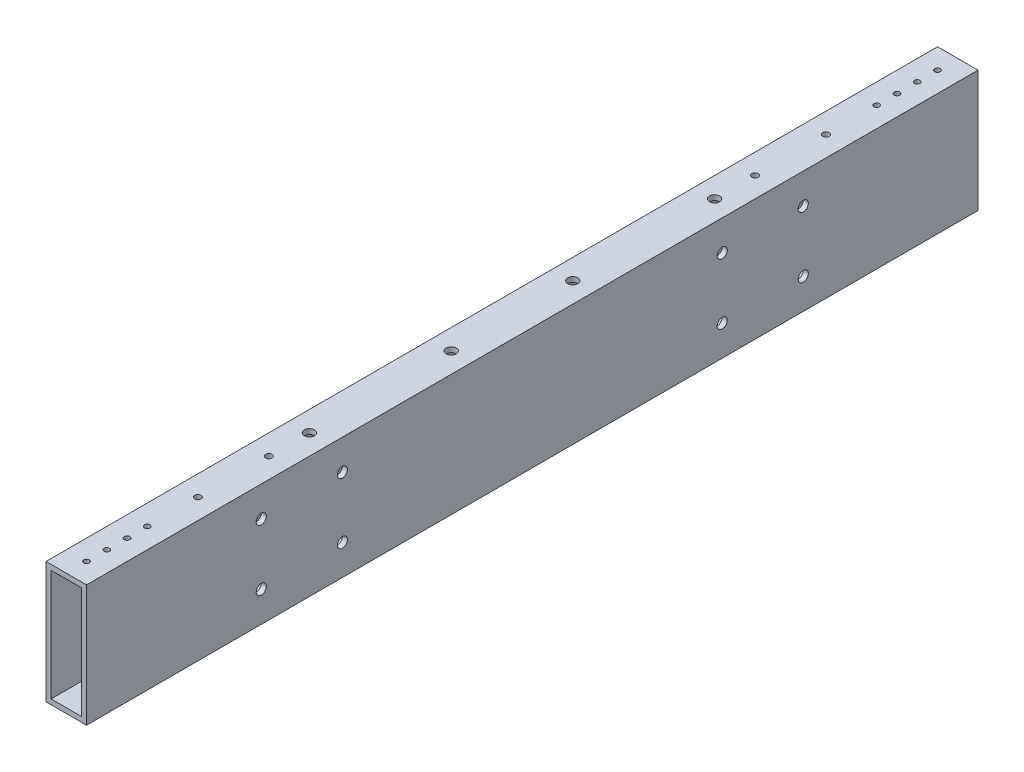
from build123d import *

# Parameters (mm, degrees)
SKETCH1_W                       = 25.4
SKETCH1_H                       = 76.2
SKETCH1_W_2                     = 19.05
SKETCH1_H_2                     = 69.85
BOSS_EXTRUDE1_DEPTH             = 279.4
SKETCH3_R                       = 1.7272
CUT_EXTRUDE2_DEPTH              = 6.35
F_1_4_0_25_DIAMETER_HOLE1_D     = 6.35
F_1_4_0_25_DIAMETER_HOLE1_DEPTH = 25.4
F_1_4_0_25_DIAMETER_HOLE1_TIP   = 1.907732465
F_1_4_0_25_DIAMETER_HOLE2_D     = 6.35
CUT_EXTRUDE3_START              = -5.08
SKETCH2_R                       = 1.7272
CUT_EXTRUDE3_DEPTH              = 5.08
F_10_32_TAPPED_HOLE1_D          = 4.0386
F_10_32_TAPPED_HOLE1_DEPTH      = 13.716
F_10_32_TAPPED_HOLE1_TIP        = 1.213317848


with BuildPart() as part:
    # Sketch1 → Boss-Extrude1 (new, symmetric)
    with BuildSketch(Plane.XY):
        Rectangle(SKETCH1_W, SKETCH1_H)
        Rectangle(SKETCH1_W_2, SKETCH1_H_2, mode=Mode.SUBTRACT)
    extrude(amount=BOSS_EXTRUDE1_DEPTH, both=True)

    # Sketch3 → Cut-Extrude2 (cut)
    with BuildSketch(Plane.XZ.offset(38.1)):
        with Locations((0, 266.7)):
            Circle(SKETCH3_R)
        with Locations((0, 241.3)):
            Circle(SKETCH3_R)
        with Locations((0, 215.9)):
            Circle(SKETCH3_R)
        with Locations((0, 190.5)):
            Circle(SKETCH3_R)
        with Locations((0, 165.1)):
            Circle(SKETCH3_R)
        with Locations((0, 139.7)):
            Circle(SKETCH3_R)
        with Locations((0, 114.3)):
            Circle(SKETCH3_R)
        with Locations((0, 88.9)):
            Circle(SKETCH3_R)
        with Locations((0, 63.5)):
            Circle(SKETCH3_R)
        with Locations((0, 38.1)):
            Circle(SKETCH3_R)
        with Locations((0, 12.7)):
            Circle(SKETCH3_R)
        with Locations((0, -12.7)):
            Circle(SKETCH3_R)
        with Locations((0, -38.1)):
            Circle(SKETCH3_R)
        with Locations((0, -63.5)):
            Circle(SKETCH3_R)
        with Locations((0, -88.9)):
            Circle(SKETCH3_R)
        with Locations((0, -114.3)):
            Circle(SKETCH3_R)
        with Locations((0, -139.7)):
            Circle(SKETCH3_R)
        with Locations((0, -165.1)):
            Circle(SKETCH3_R)
        with Locations((0, -190.5)):
            Circle(SKETCH3_R)
        with Locations((0, -215.9)):
            Circle(SKETCH3_R)
        with Locations((0, -241.3)):
            Circle(SKETCH3_R)
        with Locations((0, -266.7)):
            Circle(SKETCH3_R)
    extrude(amount=-CUT_EXTRUDE2_DEPTH, mode=Mode.SUBTRACT)

    # 1/4 (0.25) Diameter Hole1
    with Locations(Plane.ZY.offset(12.7)):
        with Locations((-119.0625, -19.05), (119.0625, -19.05), (-119.0625, 19.05), (119.0625, 19.05), (169.8625, 19.05), (169.8625, -19.05), (-169.8625, 19.05), (-169.8625, -19.05)):
            Hole(F_1_4_0_25_DIAMETER_HOLE1_D / 2, depth=F_1_4_0_25_DIAMETER_HOLE1_DEPTH)
            with Locations((0, 0, -(F_1_4_0_25_DIAMETER_HOLE1_DEPTH + F_1_4_0_25_DIAMETER_HOLE1_TIP / 2))):  # 118° drill point
                Cone(0, F_1_4_0_25_DIAMETER_HOLE1_D / 2, F_1_4_0_25_DIAMETER_HOLE1_TIP, mode=Mode.SUBTRACT)

    # 1/4 (0.25) Diameter Hole2 (through all)
    with Locations(Plane(origin=(0, 38.1, 0), x_dir=(1, 0, 0), z_dir=(0, 1, 0))):
        with Locations((0, 127), (0, -127), (0, -38.1), (0, 38.1)):
            Hole(F_1_4_0_25_DIAMETER_HOLE2_D / 2)

    # Sketch2 → Cut-Extrude3 (cut)
    with BuildSketch(Plane(origin=(0, 38.1, 0), x_dir=(1, 0, 0), z_dir=(0, 1, 0)).offset(CUT_EXTRUDE3_START)):
        with Locations((0, 266.7)):
            Circle(SKETCH2_R)
        with Locations((0, 254)):
            Circle(SKETCH2_R)
        with Locations((0, 241.3)):
            Circle(SKETCH2_R)
        with Locations((0, 228.6)):
            Circle(SKETCH2_R)
        with Locations((0, -266.7)):
            Circle(SKETCH2_R)
        with Locations((0, -254)):
            Circle(SKETCH2_R)
        with Locations((0, -241.3)):
            Circle(SKETCH2_R)
        with Locations((0, -228.6)):
            Circle(SKETCH2_R)
    extrude(amount=CUT_EXTRUDE3_DEPTH, mode=Mode.SUBTRACT)

    # #10-32 Tapped Hole1
    with Locations(Plane(origin=(0, 38.1, 0), x_dir=(1, 0, 0), z_dir=(0, 1, 0))):
        with Locations((0, -196.85), (0, -152.4), (0, 152.4), (0, 196.85)):
            Hole(F_10_32_TAPPED_HOLE1_D / 2, depth=F_10_32_TAPPED_HOLE1_DEPTH)
            with Locations((0, 0, -(F_10_32_TAPPED_HOLE1_DEPTH + F_10_32_TAPPED_HOLE1_TIP / 2))):  # 118° drill point
                Cone(0, F_10_32_TAPPED_HOLE1_D / 2, F_10_32_TAPPED_HOLE1_TIP, mode=Mode.SUBTRACT)


solid = part.part
